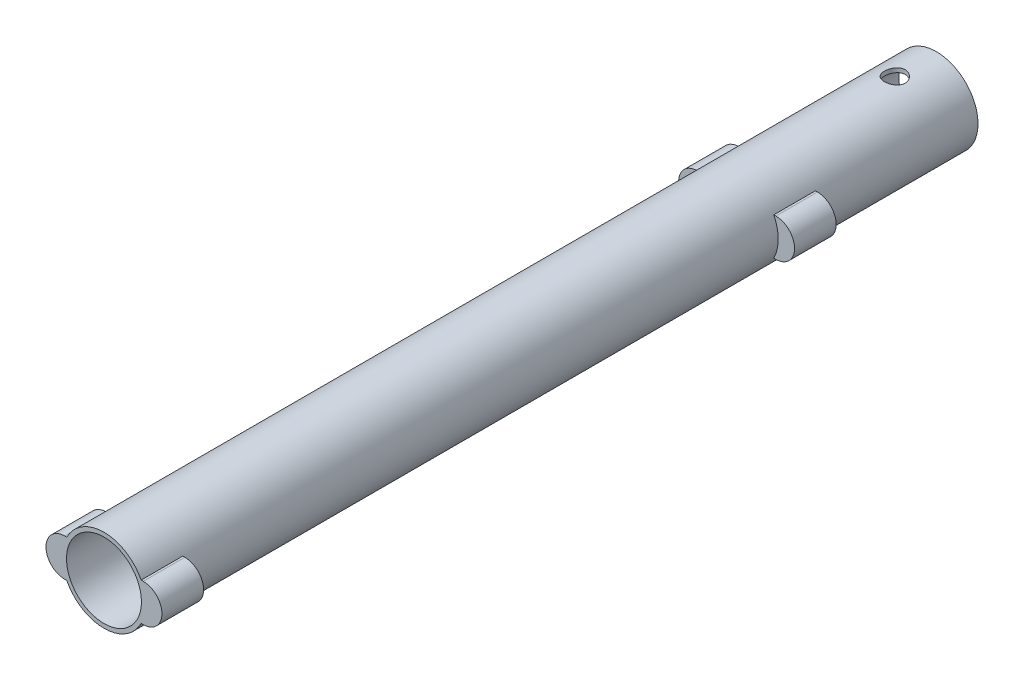
from build123d import *

# Parameters (mm, degrees)
SKETCH1_R               = 10
SKETCH1_R_2             = 9
BOSS_EXTRUDE1_DEPTH     = 200
BOSS_EXTRUDE2_START     = -10
BOSS_EXTRUDE2_DEPTH     = 10
CUT_EXTRUDE1_DEPTH      = 201.733786034
CUT_EXTRUDE1_DEPTH_BACK = 201.733786034
SKETCH3_R               = 2.5


with BuildPart() as part:
    # Sketch1 → Boss-Extrude1 (new body)
    with BuildSketch(Plane.XY):
        Circle(SKETCH1_R)
        Circle(SKETCH1_R_2, mode=Mode.SUBTRACT)
    extrude(amount=BOSS_EXTRUDE1_DEPTH)

    # Sketch2 → Boss-Extrude2 (add)
    with BuildSketch(Plane.XY.offset(200).offset(BOSS_EXTRUDE2_START)):
        with BuildLine():
            Line((-9.43028555, 4.5), (-8.93028555, 4.5))
            ThreePointArc((-8.93028555, 4.5), (-10, 0), (-8.93028555, -4.5))
            Line((-8.93028555, -4.5), (-9.43028555, -4.5))
            ThreePointArc((-9.43028555, -4.5), (-13.93028555, 0), (-9.43028555, 4.5))
        make_face()
        with BuildLine():
            Line((8.93028555, 4.5), (9.43028555, 4.5))
            ThreePointArc((9.43028555, 4.5), (13.93028555, 0), (9.43028555, -4.5))
            Line((9.43028555, -4.5), (8.93028555, -4.5))
            ThreePointArc((8.93028555, -4.5), (10, 0), (8.93028555, 4.5))
        make_face()
    boss_extrude2 = extrude(amount=BOSS_EXTRUDE2_DEPTH)

    # Mirror1: Boss-Extrude2 across plane
    add(boss_extrude2.mirror(Plane.XY.offset(119)))

    # Sketch3 → Cut-Extrude1 (cut, two sides: drawn at the far end of the back side and taken through both)
    with BuildSketch(Plane(origin=(0, 0, 0), x_dir=(1, 0, 0), z_dir=(0, 1, 0)).offset(-CUT_EXTRUDE1_DEPTH_BACK)):
        with Locations((0, -10)):
            Circle(SKETCH3_R)
    extrude(amount=CUT_EXTRUDE1_DEPTH + CUT_EXTRUDE1_DEPTH_BACK, mode=Mode.SUBTRACT)


solid = part.part
